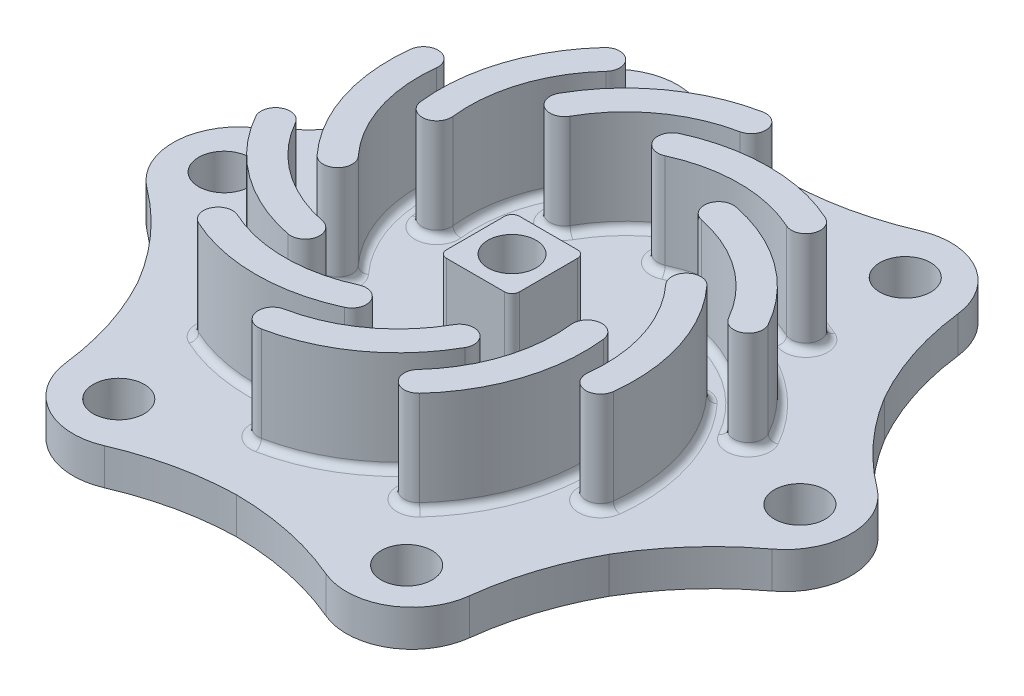
from build123d import *

# Parameters (mm, degrees)
SKETCH1_R                = 20.6375
BOSS_EXTRUDE1_DEPTH      = 3.175
SKETCH2_R                = 23.8125
SKETCH2_R_2              = 20.6375
BOSS_EXTRUDE2_DEPTH      = 3.175
SKETCH4_R                = 2.0955
BOSS_EXTRUDE3_DEPTH      = 6.35
CUT_EXTRUDE1_DEPTH       = 35.269415118
CUT_EXTRUDE1_DEPTH_BACK  = 35.269415118
SKETCH5_R                = 2.0955
BOSS_EXTRUDE4_DEPTH      = 8.89
FILLET1_R                = 0.635
CIRPATTERN1_COUNT        = 10
FILLET1_OF_CIRPATTERN1_R = 0.635
BOSS_EXTRUDE6_START      = -3.175
BOSS_EXTRUDE6_DEPTH      = 3.175
FILLET4_R                = 25.4
SKETCH9_R                = 2.2225
CUT_EXTRUDE2_DEPTH       = 39.960756193
CIRPATTERN3_DEPTH        = 3.175
CIRPATTERN3_2_DEPTH      = 3.175


# Read off the part's stored shape, not the designer's step: CirPattern3
with BuildPart() as part:
    # Sketch1 → Boss-Extrude1 (new body)
    with BuildSketch(Plane(origin=(0, 0, 0), x_dir=(1, 0, 0), z_dir=(0, 1, 0))):
        with Locations(Location((0, 0, 0), (0, 0, 270))):
            Circle(SKETCH1_R)
    extrude(amount=BOSS_EXTRUDE1_DEPTH)

    # Sketch2 → Boss-Extrude2 (add)
    with BuildSketch(Plane(origin=(0, 0, 0), x_dir=(-1, 0, 0), z_dir=(0, -1, 0))):
        with Locations(Location((0, 0, 0), (0, 0, 90))):
            Circle(SKETCH2_R)
        Circle(SKETCH2_R_2, mode=Mode.SUBTRACT)
    extrude(amount=-BOSS_EXTRUDE2_DEPTH)

    # Sketch4 → Boss-Extrude3 (add)
    with BuildSketch(Plane(origin=(0, 3.175, 0), x_dir=(1, 0, 0), z_dir=(0, 1, 0))):
        with BuildLine():
            Line((-2.54, 3.175), (2.54, 3.175))
            ThreePointArc((2.54, 3.175), (2.989012806, 2.989012806), (3.175, 2.54))
            Line((3.175, 2.54), (3.175, -2.54))
            ThreePointArc((3.175, -2.54), (2.989012806, -2.989012806), (2.54, -3.175))
            Line((2.54, -3.175), (-2.54, -3.175))
            ThreePointArc((-2.54, -3.175), (-2.989012806, -2.989012806), (-3.175, -2.54))
            Line((-3.175, -2.54), (-3.175, 2.54))
            ThreePointArc((-3.175, 2.54), (-2.989012806, 2.989012806), (-2.54, 3.175))
        make_face()
        with Locations(Location((0, 0, 0), (0, 0, 270))):
            Circle(SKETCH4_R, mode=Mode.SUBTRACT)
    extrude(amount=BOSS_EXTRUDE3_DEPTH)

    # Sketch5 → Cut-Extrude1 (cut, two sides: drawn at the far end of the back side and taken through both)
    with BuildSketch(Plane(origin=(0, 3.175, 0), x_dir=(1, 0, 0), z_dir=(0, 1, 0)).offset(-CUT_EXTRUDE1_DEPTH_BACK)):
        with Locations(Location((0, 0, 0), (0, 0, 270))):
            Circle(SKETCH5_R)
    extrude(amount=CUT_EXTRUDE1_DEPTH + CUT_EXTRUDE1_DEPTH_BACK, mode=Mode.SUBTRACT)

    # Sketch6 → Boss-Extrude4 (add)
    with BuildSketch(Plane(origin=(0, 3.175, 0), x_dir=(1, 0, 0), z_dir=(0, 1, 0))):
        with BuildLine():
            ThreePointArc((-7.544127175, 11.643981197), (-3.221501775, 16.497663014), (2.730388654, 19.108853901))
            ThreePointArc((2.730388654, 19.108853901), (4.225935878, 18.114299479), (3.231381456, 16.618752254))
            ThreePointArc((3.231381456, 16.618752254), (-1.728527235, 14.442759849), (-5.330715068, 10.398025001))
            ThreePointArc((-5.330715068, 10.398025001), (-7.060399219, 9.914297045), (-7.544127175, 11.643981197))
        make_face()
    boss_extrude4 = extrude(amount=BOSS_EXTRUDE4_DEPTH)

    # Fillet1
    fillet1_edges = [part.edges().sort_by_distance(p)[0] for p in [
        (-7.060399219, 3.175, -9.914297045),
        (-1.728527235, 3.175, -14.442759849),
        (4.225935878, 3.175, -18.114299479),
        (-3.221501775, 3.175, -16.497663014),
    ]]
    fillet(fillet1_edges, radius=FILLET1_R)

    # CirPattern1: Boss-Extrude4 ×10 about axis
    cirpattern1_axis = Axis((0, 0, 0), (0, 1, 0))
    for i in range(1, CIRPATTERN1_COUNT):
        add(boss_extrude4.rotate(cirpattern1_axis, i * 360 / CIRPATTERN1_COUNT))

    # Fillet1 of CirPattern1
    fillet1_of_cirpattern1_edges = [part.edges().sort_by_distance(p)[0] for p in [
        (-11.539460546, 3.175, -3.87083626),
        (-9.887649149, 3.175, -10.668435346),
        (-7.228464147, 3.175, -17.138718906),
        (-12.303332701, 3.175, -11.453338512),
        (-11.610840155, 3.175, 3.651152411),
        (-14.270025158, 3.175, -2.819131149),
        (-15.921836554, 3.175, -9.616730235),
        (-16.685708709, 3.175, -2.034227983),
        (-7.247273464, 3.175, 9.778524959),
        (-13.201736577, 3.175, 6.106985329),
        (-18.533608561, 3.175, 1.578522526),
        (-14.694711117, 3.175, 8.161888495),
        (-0.115494635, 3.175, 12.170833333),
        (-7.090833333, 3.175, 12.70044098),
        (-14.066172032, 3.175, 12.170833333),
        (-7.090833333, 3.175, 15.24044098),
        (7.060399219, 3.175, 9.914297045),
        (1.728527235, 3.175, 14.442759849),
        (-4.225935878, 3.175, 18.114299479),
        (3.221501775, 3.175, 16.497663014),
        (11.539460546, 3.175, 3.87083626),
        (9.887649149, 3.175, 10.668435346),
        (7.228464147, 3.175, 17.138718906),
        (12.303332701, 3.175, 11.453338512),
        (11.610840155, 3.175, -3.651152411),
        (14.270025158, 3.175, 2.819131149),
        (15.921836554, 3.175, 9.616730235),
        (16.685708709, 3.175, 2.034227983),
        (7.247273464, 3.175, -9.778524959),
        (13.201736577, 3.175, -6.106985329),
        (18.533608561, 3.175, -1.578522526),
        (14.694711117, 3.175, -8.161888495),
        (0.115494635, 3.175, -12.170833333),
        (7.090833333, 3.175, -12.70044098),
        (14.066172032, 3.175, -12.170833333),
        (7.090833333, 3.175, -15.24044098),
    ]]
    fillet(fillet1_of_cirpattern1_edges, radius=FILLET1_OF_CIRPATTERN1_R)

    # Sketch8 → Boss-Extrude6 (add)
    with BuildSketch(Plane(origin=(0, 3.175, 0), x_dir=(1, 0, 0), z_dir=(0, 1, 0)).offset(BOSS_EXTRUDE6_START)):
        with BuildLine():
            ThreePointArc((-23.1267, 5.673702791), (-29.5275, 0), (-23.1267, -5.673702791))
            ThreePointArc((-23.1267, -5.673702791), (-23.8125, 0), (-23.1267, 5.673702791))
        make_face()
    extrude(amount=BOSS_EXTRUDE6_DEPTH)

    # Fillet4
    fillet4_edges = [part.edges().sort_by_distance(p)[0] for p in [
        (-23.1267, 1.5875, -5.673702791),
        (-23.1267, 1.5875, 5.673702791),
    ]]
    fillet(fillet4_edges, radius=FILLET4_R)

    # Sketch9 → Cut-Extrude2 (cut, symmetric)
    with BuildSketch(Plane(origin=(0, 3.175, 0), x_dir=(1, 0, 0), z_dir=(0, 1, 0))):
        with Locations(Location((-25.0825, 0, 0), (0, 0, 270))):
            Circle(SKETCH9_R)
    extrude(amount=CUT_EXTRUDE2_DEPTH, both=True, mode=Mode.SUBTRACT)

    # CirPattern3 outline → CirPattern3 (cut)
    with BuildSketch(Plane(origin=(0, 0, 0), x_dir=(1, 0, 0), z_dir=(0, 1, 0))):
        with BuildLine():
            ThreePointArc((-13.411056221, 19.676857658), (-11.43, 19.79734073), (-10.335130488, 21.452744208))
            ThreePointArc((-10.335130488, 21.452744208), (-11.90625, 20.622229928), (-13.411056221, 19.676857658))
        make_face()
        with BuildLine():
            ThreePointArc((13.411056221, 19.676857658), (11.90625, 20.622229928), (10.335130488, 21.452744208))
            ThreePointArc((10.335130488, 21.452744208), (11.43, 19.79734073), (13.411056221, 19.676857658))
        make_face()
        with BuildLine():
            ThreePointArc((23.746186709, -1.77588655), (23.8125, 0), (23.746186709, 1.77588655))
            ThreePointArc((23.746186709, 1.77588655), (22.86, 0), (23.746186709, -1.77588655))
        make_face()
        with BuildLine():
            ThreePointArc((10.335130488, -21.452744208), (11.90625, -20.622229928), (13.411056221, -19.676857658))
            ThreePointArc((13.411056221, -19.676857658), (11.43, -19.79734073), (10.335130488, -21.452744208))
        make_face()
        with BuildLine():
            ThreePointArc((-13.411056221, -19.676857658), (-11.90625, -20.622229928), (-10.335130488, -21.452744208))
            ThreePointArc((-10.335130488, -21.452744208), (-11.43, -19.79734073), (-13.411056221, -19.676857658))
        make_face()
    extrude(amount=CIRPATTERN3_DEPTH, mode=Mode.SUBTRACT)

    # CirPattern3 2 outline → CirPattern3 2 (add)
    with BuildSketch(Plane(origin=(0, 0, 0), x_dir=(1, 0, 0), z_dir=(0, 1, 0))):
        with BuildLine():
            ThreePointArc((0.181296717, 23.811809838), (-4.837563965, 24.35161844), (-9.650569001, 25.873242043))
            ThreePointArc((-9.650569001, 25.873242043), (-14.764885819, 25.570909171), (-17.581908256, 21.29165383))
            ThreePointArc((-17.581908256, 21.29165383), (-18.612348128, 16.535370154), (-20.530983871, 12.062912482))
            ThreePointArc((-20.530983871, 12.062912482), (-17.392773261, 16.264273564), (-13.411056221, 19.676857658))
            ThreePointArc((-13.411056221, 19.676857658), (-13.6525, 23.64682365), (-10.335130488, 21.452744208))
            ThreePointArc((-10.335130488, 21.452744208), (-5.212138018, 23.235076362), (0.181296717, 23.811809838))
        make_face()
        with BuildLine():
            ThreePointArc((-9.648158978, -25.872206112), (-5.01387655, -24.38645138), (-0.181296717, -23.811809838))
            ThreePointArc((-0.181296717, -23.811809838), (-5.38888745, -23.194720268), (-10.335130488, -21.452744208))
            ThreePointArc((-10.335130488, -21.452744208), (-13.6525, -23.64682365), (-13.411056221, -19.676857658))
            ThreePointArc((-13.411056221, -19.676857658), (-17.392773261, -16.264273564), (-20.530983871, -12.062912482))
            ThreePointArc((-20.530983871, -12.062912482), (-18.612348128, -16.535370154), (-17.581908256, -21.29165383))
            ThreePointArc((-17.581908256, -21.29165383), (-14.76375, -25.57156511), (-9.648158978, -25.872206112))
        make_face()
        with BuildLine():
            ThreePointArc((17.581908256, -21.29165383), (18.612348128, -16.535370154), (20.530983871, -12.062912482))
            ThreePointArc((20.530983871, -12.062912482), (17.39277326, -16.264273564), (13.411056221, -19.676857658))
            ThreePointArc((13.411056221, -19.676857658), (13.6525, -23.64682365), (10.335130488, -21.452744208))
            ThreePointArc((10.335130488, -21.452744208), (5.212138018, -23.235076362), (-0.181296717, -23.811809838))
            ThreePointArc((-0.181296717, -23.811809838), (4.837563965, -24.35161844), (9.650569001, -25.873242043))
            ThreePointArc((9.650569001, -25.873242043), (14.764885819, -25.570909171), (17.581908256, -21.29165383))
        make_face()
        with BuildLine():
            ThreePointArc((27.230067234, 4.580552281), (23.626224678, 7.851081226), (20.712280588, 11.748897356))
            ThreePointArc((20.712280588, 11.748897356), (22.781660711, 6.930446704), (23.746186709, 1.77588655))
            ThreePointArc((23.746186709, 1.77588655), (27.305, 0), (23.746186709, -1.77588655))
            ThreePointArc((23.746186709, -1.77588655), (22.728235397, -7.103694249), (20.530983871, -12.062912482))
            ThreePointArc((20.530983871, -12.062912482), (23.507902174, -7.986355934), (27.232169388, -4.578983105))
            ThreePointArc((27.232169388, -4.578983105), (29.527499849, 0.001311618), (27.230067234, 4.580552281))
        make_face()
        with BuildLine():
            ThreePointArc((9.648158978, 25.872206112), (5.01387655, 24.38645138), (0.181296717, 23.811809838))
            ThreePointArc((0.181296717, 23.811809838), (5.38888745, 23.194720268), (10.335130488, 21.452744208))
            ThreePointArc((10.335130488, 21.452744208), (13.6525, 23.64682365), (13.411056221, 19.676857658))
            ThreePointArc((13.411056221, 19.676857658), (17.516097379, 16.131382113), (20.712280588, 11.748897356))
            ThreePointArc((20.712280588, 11.748897356), (18.67033821, 16.365262506), (17.581600387, 21.294258937))
            ThreePointArc((17.581600387, 21.294258937), (14.762614031, 25.572220789), (9.648158978, 25.872206112))
        make_face()
    extrude(amount=CIRPATTERN3_2_DEPTH)


solid = part.part
